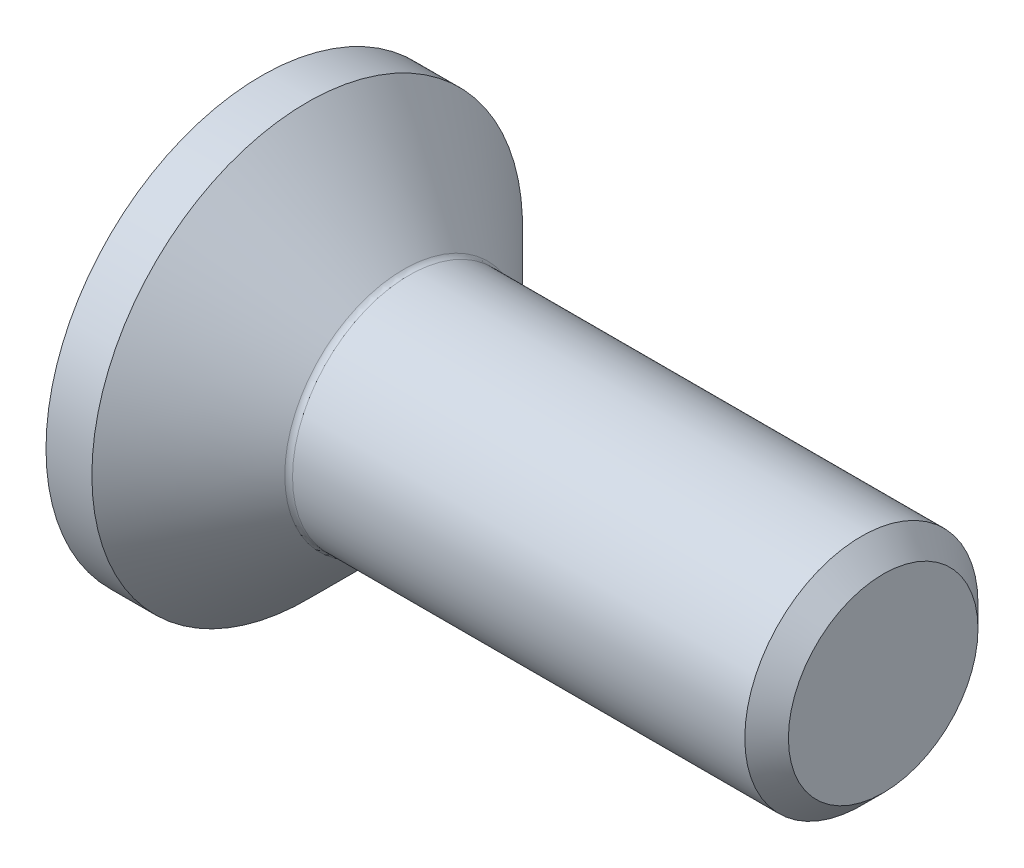
from build123d import *

# Parameters (mm, degrees)
FILLET1_R   = 0.1
HEX_START   = -1.1
HEX_2_DEPTH = 1.1


with BuildPart() as part:
    # BodySke → BaseBody (revolve)
    with BuildSketch(Plane.XY, mode=Mode.PRIVATE) as basebody_sk:
        Polygon((0, 0), (0, 2.77), (0.59, 2.77), (1.86, 1.5), (7.7195, 1.5), (8, 1.2195), (8, 0), align=None)
    revolve(basebody_sk.sketch.rotate(Axis((0, 0, 0), (1, 0, 0)), 90), axis=Axis((0, 0, 0), (1, 0, 0)))

    # Fillet1
    fillet1_edges = [part.edges().sort_by_distance(p)[0] for p in [
        (1.86, 0, -1.5),
    ]]
    fillet(fillet1_edges, radius=FILLET1_R)

    # Hex 2: read off the stored shape, not the designer's step
    # Hex 2 outline → Hex 2 (cut)
    with BuildSketch(Plane.ZY.offset(HEX_START)):
        Polygon((-1.01, -0.583123772), (0, -1.166247544), (1.01, -0.583123772), (1.01, 0.583123772), (0, 1.166247544), (-1.01, 0.583123772), align=None)
    extrude(amount=HEX_2_DEPTH, mode=Mode.SUBTRACT)

    # Hex 2 2 outline → Hex 2 2 (revolve, cut)
    with BuildSketch(Plane.YX):
        Polygon((1.01, 1.1), (0, 1.683123772), (0, 1.1), align=None)
    revolve(axis=Axis((0, 0, 0), (1, 0, 0)), mode=Mode.SUBTRACT)


solid = part.part
